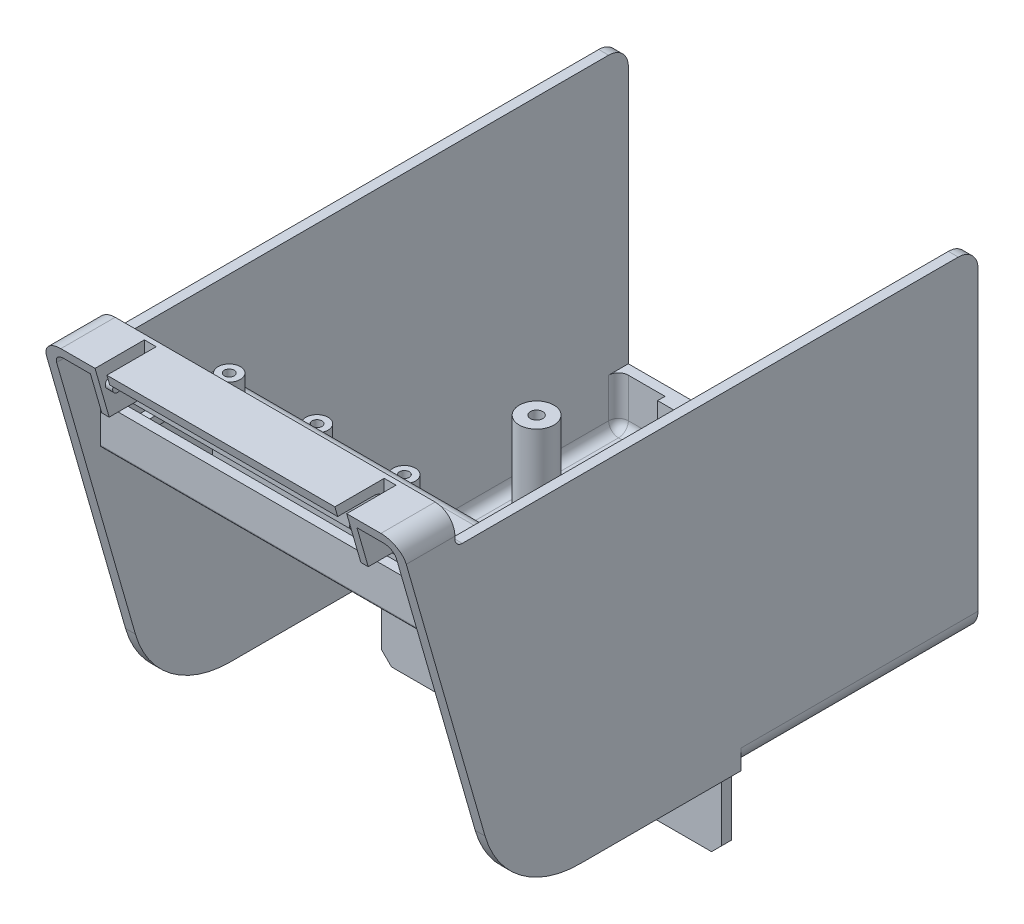
from build123d import *

# Parameters (mm, degrees)
BOSS_EXTRUDE1_DEPTH             = 66.66
BOSS_EXTRUDE1_DEPTH_BACK        = 7.5
SKETCH1_W                       = 72.85
SKETCH1_H                       = 108.98
CUT_EXTRUDE1_DEPTH              = 113.78226013
CUT_EXTRUDE1_DEPTH_BACK         = 113.78226013
FILLET1_R                       = 0.5
SHELL1_T                        = -2
CUT_EXTRUDE2_REACH              = 84.888
SKETCH3_W                       = 65
SKETCH3_H                       = 10
CUT_EXTRUDE3_REACH              = 79.417
SKETCH4_W                       = 65
SKETCH4_H                       = 10
CUT_EXTRUDE4_REACH              = 90.174
SKETCH5_W                       = 65
SKETCH5_H                       = 10
BOSS_EXTRUDE2_DEPTH             = 4.5
BOSS_EXTRUDE2_DEPTH_BACK        = 2
SKETCH7_R                       = 2.25
BOSS_EXTRUDE3_DEPTH             = 4.5
BOSS_EXTRUDE3_DEPTH_BACK        = 2
SKETCH8_R                       = 2.25
SKETCH9_R                       = 2.25
BOSS_EXTRUDE4_DEPTH             = 4.5
BOSS_EXTRUDE4_DIRECTION_2_REACH = 88.848
CUT_EXTRUDE5_REACH              = 134.842
SKETCH10_W                      = 66.016324661
SKETCH10_H                      = 3.018321317
SKETCH11_R                      = 3.5
BOSS_EXTRUDE5_DEPTH             = 19.72
BOSS_EXTRUDE6_DEPTH             = 2
SKETCH20_W                      = 68.85
SKETCH20_H                      = 10
BOSS_EXTRUDE7_DEPTH             = 2
CUT_EXTRUDE12_DEPTH             = 118.939129215
CUT_EXTRUDE6_REACH              = 106.811
SKETCH13_W                      = 68.85
SKETCH13_H                      = 2.5
FILLET4_R                       = 3
SKETCH14_W                      = 70.85
SKETCH14_H                      = 118.430630558
CUT_EXTRUDE7_DEPTH              = 1.5
CUT_EXTRUDE8_REACH              = 106.811
SKETCH16_R                      = 1.25
SKETCH17_R                      = 1
CUT_EXTRUDE9_DEPTH              = 4
SKETCH18_R                      = 1
CUT_EXTRUDE10_DEPTH             = 4
SKETCH19_R                      = 1
CUT_EXTRUDE11_DEPTH             = 4
SKETCH22_W                      = 107.98
SKETCH22_H                      = 6
CUT_EXTRUDE13_DEPTH             = 118.939129215
SKETCH23_W                      = 68.85
SKETCH23_H                      = 1
BOSS_EXTRUDE8_DEPTH             = 4
FILLET6_R                       = 2
FILLET7_R                       = 2
FILLET8_R                       = 4
SKETCH28_W                      = 68.85
SKETCH28_H                      = 2
BOSS_EXTRUDE10_DEPTH            = 15.2
CHAMFER2_SIZE                   = 2
SKETCH29_R                      = 1.75
CUT_EXTRUDE16_DEPTH             = 102.288381491
FILLET10_R                      = 2
CUT_EXTRUDE17_DEPTH             = 49.98
SKETCH31_W                      = 2.5
SKETCH31_H                      = 68.16
CUT_EXTRUDE18_DEPTH             = 89.83
BOSS_EXTRUDE11_START            = 0.52
BOSS_EXTRUDE11_DEPTH            = 0.52
SKETCH33_W                      = 68.85
SKETCH33_H                      = 2
BOSS_EXTRUDE12_DEPTH            = 10
FILLET11_R                      = 2
FILLET12_R                      = 4
FILLET13_R                      = 1.5
BOSS_EXTRUDE13_REACH            = 105.406
SKETCH34_W                      = 6
SKETCH34_H                      = 1.5
SKETCH35_R                      = 1.1
CUT_EXTRUDE19_DEPTH             = 3.5
FILLET14_R                      = 2
SKETCH37_W                      = 9.007568807
SKETCH37_H                      = 2
CUT_EXTRUDE20_DEPTH             = 130.596821817
SKETCH44_W                      = 1.5
SKETCH44_H                      = 9.426509228
BOSS_EXTRUDE16_DEPTH            = 8
SKETCH45_R                      = 1
BOSS_EXTRUDE17_DEPTH            = 1.5
CUT_EXTRUDE23_DEPTH             = 109.309593081
SKETCH48_W                      = 2.4
SKETCH48_H                      = 10
CUT_EXTRUDE25_DEPTH             = 2
SKETCH49_W                      = 2.4
SKETCH49_H                      = 2
CUT_EXTRUDE26_DEPTH             = 5


with BuildPart() as part:
    # Sketch1 → Boss-Extrude1 (new, two sides: drawn at the far end of the back side and taken through both)
    with BuildSketch(Plane(origin=(0, 0, 0), x_dir=(1, 0, 0), z_dir=(0, 1, 0)).offset(-BOSS_EXTRUDE1_DEPTH_BACK)):
        Rectangle(SKETCH1_W, SKETCH1_H)
    extrude(amount=BOSS_EXTRUDE1_DEPTH + BOSS_EXTRUDE1_DEPTH_BACK)

    # Sketch2 → Cut-Extrude1 (cut, two sides: drawn at the far end of the back side and taken through both)
    with BuildSketch(Plane(origin=(36.425, 0, 0), x_dir=(0, 0, -1), z_dir=(1, 0, 0)).offset(-CUT_EXTRUDE1_DEPTH_BACK)):
        Polygon((-54.49, 340.29873767), (-54.49, 66.66), (-54.49, 43.24), (-31.71, 43.24), (-31.71, 25.46), (-14.01, 25.46), (-14.01, 7.68), (2.51, 7.68), (2.51, -7.5), (2.51, -281.13873767), (-542.479756722, -331.126737051), (-599.479756722, 290.310738288), align=None)
    extrude(amount=CUT_EXTRUDE1_DEPTH + CUT_EXTRUDE1_DEPTH_BACK, mode=Mode.SUBTRACT)

    # Fillet1
    fillet1_edges = [part.edges().sort_by_distance(p)[0] for p in [
        (0, 43.24, 54.49),
        (0, 43.24, 31.71),
        (0, 25.46, 31.71),
        (0, 25.46, 14.01),
        (0, 7.68, 14.01),
        (0, 7.68, -2.51),
    ]]
    fillet(fillet1_edges, radius=FILLET1_R)

    # Shell1
    shell1_openings = [part.faces().sort_by_distance(p)[0] for p in [
        (0, 66.66, 0),
        (0, 29.58, -54.49),
    ]]
    offset(amount=SHELL1_T, openings=shell1_openings, kind=Kind.INTERSECTION)

    # Sketch3 → Cut-Extrude2 (cut, up to next)
    with BuildSketch(Plane.XZ.offset(-43.24), mode=Mode.PRIVATE) as cut_extrude2_sk1:
        with Locations((0, 42.39)):
            Rectangle(SKETCH3_W, SKETCH3_H)
    cut_extrude2_tool1 = extrude(cut_extrude2_sk1.sketch, amount=-CUT_EXTRUDE2_REACH, mode=Mode.PRIVATE) & part.part
    add(cut_extrude2_tool1.solids().sort_by_distance((0, 43.24, 42.39))[0], mode=Mode.SUBTRACT)

    # Sketch4 → Cut-Extrude3 (cut, up to next)
    with BuildSketch(Plane.XZ.offset(-25.46), mode=Mode.PRIVATE) as cut_extrude3_sk1:
        with Locations((0, 24.61)):
            Rectangle(SKETCH4_W, SKETCH4_H)
    cut_extrude3_tool1 = extrude(cut_extrude3_sk1.sketch, amount=-CUT_EXTRUDE3_REACH, mode=Mode.PRIVATE) & part.part
    add(cut_extrude3_tool1.solids().sort_by_distance((0, 25.46, 24.61))[0], mode=Mode.SUBTRACT)

    # Sketch5 → Cut-Extrude4 (cut, up to next)
    with BuildSketch(Plane.XZ.offset(-7.68), mode=Mode.PRIVATE) as cut_extrude4_sk1:
        with Locations((0, 6.91)):
            Rectangle(SKETCH5_W, SKETCH5_H)
    cut_extrude4_tool1 = extrude(cut_extrude4_sk1.sketch, amount=-CUT_EXTRUDE4_REACH, mode=Mode.PRIVATE) & part.part
    add(cut_extrude4_tool1.solids().sort_by_distance((0, 7.68, 6.91))[0], mode=Mode.SUBTRACT)

    # Sketch7 → Boss-Extrude2 (add, two sides: drawn at the far end of the back side and taken through both)
    with BuildSketch(Plane(origin=(0, 45.24, 0), x_dir=(1, 0, 0), z_dir=(0, 1, 0)).offset(-BOSS_EXTRUDE2_DEPTH_BACK)):
        with Locations(Location((-28, -34.79, 0), (0, 0, 270))):
            Circle(SKETCH7_R)
        with Locations(Location((28, -34.79, 0), (0, 0, 270))):
            Circle(SKETCH7_R)
    extrude(amount=BOSS_EXTRUDE2_DEPTH + BOSS_EXTRUDE2_DEPTH_BACK)

    # Sketch8 → Boss-Extrude3 (add, two sides: drawn at the far end of the back side and taken through both)
    with BuildSketch(Plane(origin=(0, 27.46, 0), x_dir=(1, 0, 0), z_dir=(0, 1, 0)).offset(-BOSS_EXTRUDE3_DEPTH_BACK)):
        with Locations(Location((-28, -17.01, 0), (0, 0, 270))):
            Circle(SKETCH8_R)
        with Locations(Location((28, -17.01, 0), (0, 0, 270))):
            Circle(SKETCH8_R)
    extrude(amount=BOSS_EXTRUDE3_DEPTH + BOSS_EXTRUDE3_DEPTH_BACK)

    # Sketch9 → Boss-Extrude4 (add)
    with BuildSketch(Plane(origin=(0, 9.68, 0), x_dir=(1, 0, 0), z_dir=(0, 1, 0))):
        with Locations(Location((-28, 0.69, 0), (0, 0, 270))):
            Circle(SKETCH9_R)
        with Locations(Location((28, 0.69, 0), (0, 0, 270))):
            Circle(SKETCH9_R)
    extrude(amount=BOSS_EXTRUDE4_DEPTH)

    # Sketch9 → Boss-Extrude4 direction 2 (add, up to next)
    with BuildSketch(Plane(origin=(0, 9.68, 0), x_dir=(1, 0, 0), z_dir=(0, 1, 0)), mode=Mode.PRIVATE) as boss_extrude4_direction_2_sk1:
        with Locations(Location((-28, 0.69, 0), (0, 0, 270))):
            Circle(SKETCH9_R)
    boss_extrude4_direction_2_tool1 = extrude(boss_extrude4_direction_2_sk1.sketch, amount=-BOSS_EXTRUDE4_DIRECTION_2_REACH, mode=Mode.PRIVATE) - part.part
    # Sketch9 → Boss-Extrude4 direction 2 (add, up to next)
    with BuildSketch(Plane(origin=(0, 9.68, 0), x_dir=(1, 0, 0), z_dir=(0, 1, 0)), mode=Mode.PRIVATE) as boss_extrude4_direction_2_sk2:
        with Locations(Location((28, 0.69, 0), (0, 0, 270))):
            Circle(SKETCH9_R)
    boss_extrude4_direction_2_tool2 = extrude(boss_extrude4_direction_2_sk2.sketch, amount=-BOSS_EXTRUDE4_DIRECTION_2_REACH, mode=Mode.PRIVATE) - part.part
    add(boss_extrude4_direction_2_tool1.solids().sort_by_distance((-28, 9.68, -0.69))[0])
    add(boss_extrude4_direction_2_tool2.solids().sort_by_distance((28, 9.68, -0.69))[0])

    # Sketch10 → Cut-Extrude5 (cut, up to next)
    with BuildSketch(Plane.XY.offset(54.49), mode=Mode.PRIVATE) as cut_extrude5_sk1:
        with Locations((0.072172778, 52.849160659)):
            Rectangle(SKETCH10_W, SKETCH10_H)
    cut_extrude5_tool1 = extrude(cut_extrude5_sk1.sketch, amount=-CUT_EXTRUDE5_REACH, mode=Mode.PRIVATE) & part.part
    add(cut_extrude5_tool1.solids().sort_by_distance((0.072173, 52.849161, 54.49))[0], mode=Mode.SUBTRACT)

    # Sketch11 → Boss-Extrude5 (add)
    with BuildSketch(Plane(origin=(0, -5.5, 0), x_dir=(1, 0, 0), z_dir=(0, 1, 0))):
        with Locations(Location((-25, 24.49, 0), (0, 0, 90))):
            Circle(SKETCH11_R)
        with Locations(Location((25, 24.49, 0), (0, 0, 90))):
            Circle(SKETCH11_R)
    extrude(amount=BOSS_EXTRUDE5_DEPTH)

    # Sketch12 → Boss-Extrude6 (add)
    with BuildSketch(Plane.ZY.offset(36.425)):
        with BuildLine():
            Line((54.49, 66.66), (64.49, 66.66))
            Line((64.49, 66.66), (47.379115109, 6.987252884))
            ThreePointArc((47.379115109, 6.987252884), (40.190181653, -3.472710201), (28.15388119, -7.5))
            Line((28.15388119, -7.5), (-54.49, -7.5))
            Line((-54.49, -7.5), (54.49, 66.66))
        make_face()
    boss_extrude6 = extrude(amount=-BOSS_EXTRUDE6_DEPTH)

    # Mirror1: Boss-Extrude6 across plane
    add(boss_extrude6.mirror(Plane(origin=(0, 0, 0), x_dir=(0, 0, 1), z_dir=(1, 0, 0))))

    # Sketch20 → Boss-Extrude7 (add)
    with BuildSketch(Plane(origin=(0, 66.66, 0), x_dir=(1, 0, 0), z_dir=(0, 1, 0))):
        with Locations((0, -59.49)):
            Rectangle(SKETCH20_W, SKETCH20_H)
    extrude(amount=-BOSS_EXTRUDE7_DEPTH)

    # Sketch21 → Cut-Extrude12 (cut, through all)
    with BuildSketch(Plane(origin=(36.425, 0, 0), x_dir=(0, 0, -1), z_dir=(1, 0, 0))):
        Polygon((-64.49, 66.66), (-63.712511028, 63.948573728), (-66.437180196, 63.948573728), align=None)
    extrude(amount=-CUT_EXTRUDE12_DEPTH, mode=Mode.SUBTRACT)

    # Sketch13 → Cut-Extrude6 (cut, up to next)
    with BuildSketch(Plane.XZ.offset(7.5), mode=Mode.PRIVATE) as cut_extrude6_sk1:
        with Locations((0, -53.24)):
            Rectangle(SKETCH13_W, SKETCH13_H)
    cut_extrude6_tool1 = extrude(cut_extrude6_sk1.sketch, amount=-CUT_EXTRUDE6_REACH, mode=Mode.PRIVATE) & part.part
    add(cut_extrude6_tool1.solids().sort_by_distance((0, -7.5, -53.24))[0], mode=Mode.SUBTRACT)

    # Fillet4
    fillet4_edges = [part.edges().sort_by_distance(p)[0] for p in [
        (35.425, 66.66, -54.49),
        (-35.425, 66.66, -54.49),
    ]]
    fillet(fillet4_edges, radius=FILLET4_R)

    # Sketch14 → Cut-Extrude7 (cut)
    with BuildSketch(Plane(origin=(0, 66.66, 0), x_dir=(1, 0, 0), z_dir=(0, 1, 0))):
        with Locations((0, 5.725315279)):
            Rectangle(SKETCH14_W, SKETCH14_H)
    extrude(amount=-CUT_EXTRUDE7_DEPTH, mode=Mode.SUBTRACT)

    # Sketch16 → Cut-Extrude8 (cut, up to next)
    with BuildSketch(Plane.XZ.offset(7.5), mode=Mode.PRIVATE) as cut_extrude8_sk1:
        with Locations(Location((-25, -24.49, 0), (0, 0, 270))):
            Circle(SKETCH16_R)
    cut_extrude8_tool1 = extrude(cut_extrude8_sk1.sketch, amount=-CUT_EXTRUDE8_REACH, mode=Mode.PRIVATE) & part.part
    # Sketch16 → Cut-Extrude8 (cut, up to next)
    with BuildSketch(Plane.XZ.offset(7.5), mode=Mode.PRIVATE) as cut_extrude8_sk2:
        with Locations(Location((25, -24.49, 0), (0, 0, 270))):
            Circle(SKETCH16_R)
    cut_extrude8_tool2 = extrude(cut_extrude8_sk2.sketch, amount=-CUT_EXTRUDE8_REACH, mode=Mode.PRIVATE) & part.part
    add(cut_extrude8_tool1.solids().sort_by_distance((-25, -7.5, -24.49))[0], mode=Mode.SUBTRACT)
    add(cut_extrude8_tool2.solids().sort_by_distance((25, -7.5, -24.49))[0], mode=Mode.SUBTRACT)

    # Sketch17 → Cut-Extrude9 (cut)
    with BuildSketch(Plane(origin=(0, 14.18, 0), x_dir=(1, 0, 0), z_dir=(0, 1, 0))):
        with Locations(Location((-28, 0.69, 0), (0, 0, 270))):
            Circle(SKETCH17_R)
        with Locations(Location((28, 0.69, 0), (0, 0, 270))):
            Circle(SKETCH17_R)
    extrude(amount=-CUT_EXTRUDE9_DEPTH, mode=Mode.SUBTRACT)

    # Sketch18 → Cut-Extrude10 (cut)
    with BuildSketch(Plane(origin=(0, 31.96, 0), x_dir=(1, 0, 0), z_dir=(0, 1, 0))):
        with Locations(Location((-28, -17.01, 0), (0, 0, 270))):
            Circle(SKETCH18_R)
        with Locations(Location((28, -17.01, 0), (0, 0, 270))):
            Circle(SKETCH18_R)
    extrude(amount=-CUT_EXTRUDE10_DEPTH, mode=Mode.SUBTRACT)

    # Sketch19 → Cut-Extrude11 (cut)
    with BuildSketch(Plane(origin=(0, 49.74, 0), x_dir=(1, 0, 0), z_dir=(0, 1, 0))):
        with Locations(Location((-28, -34.79, 0), (0, 0, 270))):
            Circle(SKETCH19_R)
        with Locations(Location((28, -34.79, 0), (0, 0, 270))):
            Circle(SKETCH19_R)
    extrude(amount=-CUT_EXTRUDE11_DEPTH, mode=Mode.SUBTRACT)

    # Sketch22 → Cut-Extrude13 (cut, through all)
    with BuildSketch(Plane(origin=(36.425, 0, 0), x_dir=(0, 0, -1), z_dir=(1, 0, 0))):
        with Locations((0.5, 63.66)):
            Rectangle(SKETCH22_W, SKETCH22_H)
    extrude(amount=-CUT_EXTRUDE13_DEPTH, mode=Mode.SUBTRACT)

    # Sketch23 → Boss-Extrude8 (add)
    with BuildSketch(Plane(origin=(0, 60.66, 0), x_dir=(1, 0, 0), z_dir=(0, 1, 0))):
        with Locations((0, -52.99)):
            Rectangle(SKETCH23_W, SKETCH23_H)
    extrude(amount=BOSS_EXTRUDE8_DEPTH)

    # Fillet6
    fillet6_edges = [part.edges().sort_by_distance(p)[0] for p in [
        (34.425, 64.66, 52.99),
        (-34.425, 64.66, 52.99),
    ]]
    fillet(fillet6_edges, radius=FILLET6_R)

    # Fillet7
    fillet7_edges = [part.edges().sort_by_distance(p)[0] for p in [
        (34.425, 64.66, 59.203254614),
        (-34.425, 64.66, 59.203254614),
    ]]
    fillet(fillet7_edges, radius=FILLET7_R)

    # Fillet8
    fillet8_edges = [part.edges().sort_by_distance(p)[0] for p in [
        (36.425, 66.66, 58.99),
        (-36.425, 66.66, 58.99),
    ]]
    fillet(fillet8_edges, radius=FILLET8_R)

    # Sketch28 → Boss-Extrude10 (add)
    with BuildSketch(Plane.XZ.offset(7.5)):
        with Locations((0, -3.51)):
            Rectangle(SKETCH28_W, SKETCH28_H)
    extrude(amount=BOSS_EXTRUDE10_DEPTH)

    # Chamfer2
    chamfer2_edges = [part.edges().sort_by_distance(p)[0] for p in [
        (-34.425, -22.7, -3.51),
        (34.425, -22.7, -3.51),
    ]]
    chamfer(chamfer2_edges, length=CHAMFER2_SIZE)

    # Sketch29 → Cut-Extrude16 (cut, through all)
    with BuildSketch(Plane.XY.offset(-2.51)):
        with Locations((-24.425, -14.7)):
            Circle(SKETCH29_R)
        with Locations((24.425, -14.7)):
            Circle(SKETCH29_R)
    extrude(amount=-CUT_EXTRUDE16_DEPTH, mode=Mode.SUBTRACT)

    # Fillet10
    fillet10_edges = [part.edges().sort_by_distance(p)[0] for p in [
        (-34.425, -5.5, -28.25),
        (34.425, -5.5, -28.25),
    ]]
    fillet(fillet10_edges, radius=FILLET10_R)

    # Sketch30 → Cut-Extrude17 (cut)
    with BuildSketch(Plane(origin=(0, 0, -54.49), x_dir=(-1, 0, 0), z_dir=(0, 0, -1))):
        with BuildLine():
            Line((-36.425, -3.5), (-36.425, -7.5))
            Line((-36.425, -7.5), (-32.425, -7.5))
            ThreePointArc((-32.425, -7.5), (-35.253427125, -6.328427125), (-36.425, -3.5))
        make_face()
        with BuildLine():
            Line((36.425, -7.5), (32.425, -7.5))
            ThreePointArc((32.425, -7.5), (35.253427125, -6.328427125), (36.425, -3.5))
            Line((36.425, -3.5), (36.425, -7.5))
        make_face()
    extrude(amount=-CUT_EXTRUDE17_DEPTH, mode=Mode.SUBTRACT)

    # Sketch31 → Cut-Extrude18 (cut, symmetric)
    with BuildSketch(Plane.ZY):
        with Locations((-53.24, 26.58)):
            Rectangle(SKETCH31_W, SKETCH31_H)
    extrude(amount=CUT_EXTRUDE18_DEPTH, both=True, mode=Mode.SUBTRACT)

    # Sketch32 → Boss-Extrude11 (add)
    with BuildSketch(Plane(origin=(0, 0, -51.99), x_dir=(-1, 0, 0), z_dir=(0, 0, -1)).offset(BOSS_EXTRUDE11_START)):
        with BuildLine():
            Line((-34.425, -3.5), (-34.425, 60.66))
            Line((-34.425, 60.66), (-36.425, 60.66))
            Line((-36.425, 60.66), (-36.425, -3.5))
            ThreePointArc((-36.425, -3.5), (-35.253427125, -6.328427125), (-32.425, -7.5))
            Line((-32.425, -7.5), (32.425, -7.5))
            ThreePointArc((32.425, -7.5), (35.253427125, -6.328427125), (36.425, -3.5))
            Line((36.425, -3.5), (36.425, 60.66))
            Line((36.425, 60.66), (34.425, 60.66))
            Line((34.425, 60.66), (34.425, -3.5))
            ThreePointArc((34.425, -3.5), (33.839213562, -4.914213562), (32.425, -5.5))
            Line((32.425, -5.5), (-32.425, -5.5))
            ThreePointArc((-32.425, -5.5), (-33.839213562, -4.914213562), (-34.425, -3.5))
        make_face()
    extrude(amount=-BOSS_EXTRUDE11_DEPTH)

    # Sketch33 → Boss-Extrude12 (add)
    with BuildSketch(Plane(origin=(0, -5.5, 0), x_dir=(1, 0, 0), z_dir=(0, 1, 0))):
        with Locations((0, 51.51)):
            Rectangle(SKETCH33_W, SKETCH33_H)
    extrude(amount=BOSS_EXTRUDE12_DEPTH)

    # Fillet11
    fillet11_edges = [part.edges().sort_by_distance(p)[0] for p in [
        (33.839213562, -4.914213562, -50.51),
        (-34.425, 0.5, -50.51),
        (-33.839213562, -4.914213562, -50.51),
        (0, -5.5, -50.51),
        (34.425, 0.5, -50.51),
    ]]
    fillet(fillet11_edges, radius=FILLET11_R)

    # Fillet12
    fillet12_edges = [part.edges().sort_by_distance(p)[0] for p in [
        (35.425, 60.66, -52.51),
        (-35.425, 60.66, -52.51),
    ]]
    fillet(fillet12_edges, radius=FILLET12_R)

    # Fillet13
    # the kernel refuses this fillet: 1.5 mm, written as the material it adds along each edge
    with BuildSketch(Plane(origin=(-34.425, 60.66, 53.49), x_dir=(0, 0, -1), z_dir=(-1, 0, 0))) as fillet13_piece_1:
        with BuildLine():
            CenterArc((FILLET13_R, -FILLET13_R), FILLET13_R, 90, 90)
            Line((0, -FILLET13_R), (0, 0))
            Line((0, 0), (FILLET13_R, 0))
        make_face()
    extrude(amount=2)
    with BuildSketch(Plane(origin=(36.425, 60.66, 53.49), x_dir=(0, 1, 0), z_dir=(-1, 0, 0))) as fillet13_piece_2:
        with BuildLine():
            CenterArc((FILLET13_R, FILLET13_R), FILLET13_R, 180, 90)
            Line((0, FILLET13_R), (0, 0))
            Line((0, 0), (FILLET13_R, 0))
        make_face()
    extrude(amount=2)

    # Boss-Extrude13: up to this face of the body (flat: up to its plane)
    boss_extrude13_end = Plane(part.part.faces().sort_by_distance((0, 4.5, -51.49218452))[0])
    # Sketch34 → Boss-Extrude13 (add, up to the picked face)
    with BuildSketch(Plane(origin=(0, -5.5, 0), x_dir=(1, 0, 0), z_dir=(0, 1, 0)), mode=Mode.PRIVATE) as boss_extrude13_sk1:
        with Locations((-22, 49.76)):
            Rectangle(SKETCH34_W, SKETCH34_H)
    boss_extrude13_tool1 = split(extrude(boss_extrude13_sk1.sketch, amount=BOSS_EXTRUDE13_REACH, mode=Mode.PRIVATE), bisect_by=boss_extrude13_end, keep=Keep.BOTH, mode=Mode.PRIVATE)
    boss_extrude13 = boss_extrude13_tool1.solids().sort_by(Axis((-22, -5.5, -49.76), (0, 1, 0)))[0]
    add(boss_extrude13)

    # Sketch35 → Cut-Extrude19 (cut)
    with BuildSketch(Plane(origin=(0, 0, -52.51), x_dir=(-1, 0, 0), z_dir=(0, 0, -1))):
        with Locations((22, 0.5)):
            Circle(SKETCH35_R)
    cut_extrude19 = extrude(amount=-CUT_EXTRUDE19_DEPTH, mode=Mode.SUBTRACT)

    # Mirror2: Boss-Extrude13, Cut-Extrude19 across plane
    add(boss_extrude13.mirror(Plane(origin=(0, 0, 0), x_dir=(0, 0, 1), z_dir=(1, 0, 0))))
    add(cut_extrude19.mirror(Plane(origin=(0, 0, 0), x_dir=(0, 0, 1), z_dir=(1, 0, 0))), mode=Mode.SUBTRACT)

    # Fillet14
    # the kernel refuses this fillet: 2 mm, written as the material it adds along each edge
    with BuildSketch(Plane(origin=(37.425, 64.66, 54.49), x_dir=(0, 0, 1), z_dir=(-1, 0, 0))) as fillet14_piece_1_section:
        with BuildLine():
            CenterArc((FILLET14_R, -FILLET14_R), FILLET14_R, 90, 90)
            Line((0, -FILLET14_R), (0, 0))
            Line((0, 0), (FILLET14_R, 0))
        make_face()
    fillet14_piece_1 = extrude(amount=74.85, mode=Mode.PRIVATE)
    fillet14_piece_1 = split(fillet14_piece_1, bisect_by=Plane(origin=(34.425, 64.063727496, 54.836272503), z_dir=(-1, 0, 0)), keep=Keep.TOP, mode=Mode.PRIVATE)
    fillet14_piece_1 = split(fillet14_piece_1, bisect_by=Plane(origin=(-34.425, 64.063727496, 54.836272503), z_dir=(1, 0, 0)), keep=Keep.TOP, mode=Mode.PRIVATE)
    add(fillet14_piece_1)

    # Sketch37 → Cut-Extrude20 (cut, through all)
    with BuildSketch(Plane.XY.offset(52.49)):
        with Locations((-15.003784404, 63.66)):
            Rectangle(SKETCH37_W, SKETCH37_H)
        with Locations((15.003784404, 63.66)):
            Rectangle(SKETCH37_W, SKETCH37_H)
    extrude(amount=CUT_EXTRUDE20_DEPTH, mode=Mode.SUBTRACT)

    # Sketch44 → Boss-Extrude16 (add)
    with BuildSketch(Plane.XZ.offset(-64.66)):
        with Locations((-26.25, 59.203254614)):
            Rectangle(SKETCH44_W, SKETCH44_H)
    boss_extrude16 = extrude(amount=BOSS_EXTRUDE16_DEPTH)

    # Sketch45 → Boss-Extrude17 (add)
    with BuildSketch(Plane(origin=(-25.5, 0, 0), x_dir=(0, 0, -1), z_dir=(1, 0, 0))):
        with Locations(Location((-61.416509228, 62.66, 0), (0, 0, 180))):
            Circle(SKETCH45_R)
    boss_extrude17 = extrude(amount=BOSS_EXTRUDE17_DEPTH)

    # Sketch46 → Cut-Extrude23 (cut, through all)
    with BuildSketch(Plane(origin=(-19.507568807, 0, 0), x_dir=(0, 0, -1), z_dir=(1, 0, 0))):
        Polygon((-61.622546142, 56.66), (-63.916509228, 64.66), (-63.916509228, 56.66), align=None)
    cut_extrude23 = extrude(amount=-CUT_EXTRUDE23_DEPTH, mode=Mode.SUBTRACT)

    # Mirror3: Boss-Extrude16, Boss-Extrude17, Cut-Extrude23 across plane
    add(boss_extrude16.mirror(Plane(origin=(0, 0, 0), x_dir=(0, 0, 1), z_dir=(1, 0, 0))))
    add(boss_extrude17.mirror(Plane(origin=(0, 0, 0), x_dir=(0, 0, 1), z_dir=(1, 0, 0))))
    add(cut_extrude23.mirror(Plane(origin=(0, 0, 0), x_dir=(0, 0, 1), z_dir=(1, 0, 0))), mode=Mode.SUBTRACT)

    # Sketch48 → Cut-Extrude25 (cut)
    with BuildSketch(Plane(origin=(0, 66.66, 0), x_dir=(1, 0, 0), z_dir=(0, 1, 0))):
        with Locations((-24.3, -59.49)):
            Rectangle(SKETCH48_W, SKETCH48_H)
        with Locations((24.3, -59.49)):
            Rectangle(SKETCH48_W, SKETCH48_H)
    extrude(amount=-CUT_EXTRUDE25_DEPTH, mode=Mode.SUBTRACT)

    # Sketch49 → Cut-Extrude26 (cut)
    with BuildSketch(Plane(origin=(0, 64.66, 0), x_dir=(1, 0, 0), z_dir=(0, 1, 0))):
        with Locations((-24.3, -55.49)):
            Rectangle(SKETCH49_W, SKETCH49_H)
        with Locations((24.3, -55.49)):
            Rectangle(SKETCH49_W, SKETCH49_H)
    extrude(amount=-CUT_EXTRUDE26_DEPTH, mode=Mode.SUBTRACT)


solid = part.part
